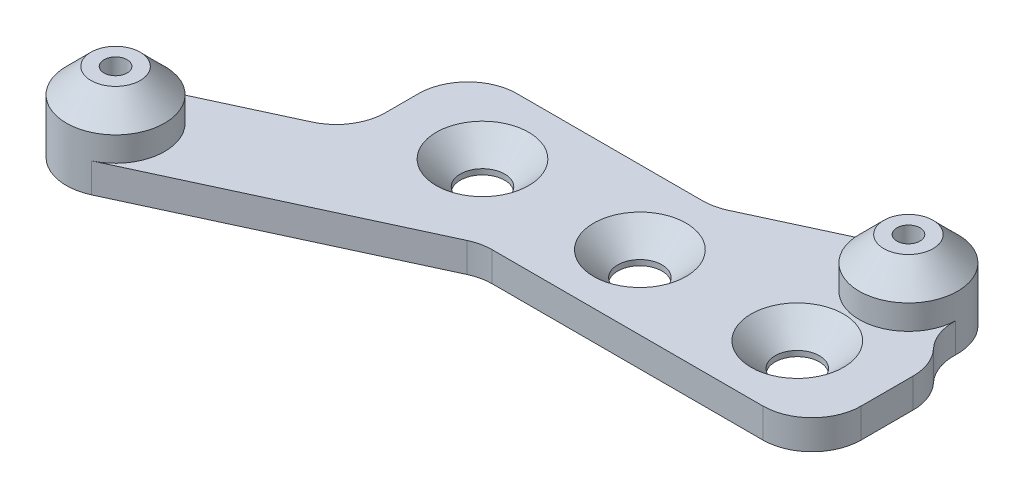
from build123d import *

# Parameters (mm, degrees)
BOSS_EXTRUDE2_DEPTH                          = 3
SKETCH4_W                                    = 50
SKETCH4_H                                    = 15
BOSS_EXTRUDE3_DEPTH                          = 3
SKETCH6_R                                    = 5
BOSS_EXTRUDE4_DEPTH                          = 5
FILLET1_R                                    = 5
FILLET2_R                                    = 5
CSK_FOR_M4_COUNTERSUNK_FLAT_HEAD_SCR_2_COUNT = 2
CSK_FOR_M4_COUNTERSUNK_FLAT_HEAD_SCR_2_PITCH = 16
CSK_FOR_M4_COUNTERSUNK_FLAT_HEAD_SCR_3_COUNT = 2
CSK_FOR_M4_COUNTERSUNK_FLAT_HEAD_SCR_3_PITCH = 16
SKETCH9_R                                    = 1.175
CUT_EXTRUDE2_DEPTH                           = 49.125772869
CHAMFER1_SIZE                                = 2.5


with BuildPart() as part:
    # Sketch2 → Boss-Extrude2 (new body)
    with BuildSketch(Plane(origin=(0, 0, 0), x_dir=(1, 0, 0), z_dir=(0, 1, 0))):
        with BuildLine():
            Line((-35.700010115, -20.037625203), (19.399989885, 5.462374797))
            ThreePointArc((19.399989885, 5.462374797), (21.837625203, 12.099989885), (15.200010115, 14.537625203))
            Line((15.200010115, 14.537625203), (-39.899989885, -10.962374797))
            ThreePointArc((-39.899989885, -10.962374797), (-42.337625203, -17.599989885), (-35.700010115, -20.037625203))
        make_face()
    extrude(amount=BOSS_EXTRUDE2_DEPTH)

    # Sketch4 → Boss-Extrude3 (add)
    with BuildSketch(Plane(origin=(0, 0, 0), x_dir=(1, 0, 0), z_dir=(0, 1, 0))):
        Rectangle(SKETCH4_W, SKETCH4_H)
    extrude(amount=BOSS_EXTRUDE3_DEPTH)

    # Sketch6 → Boss-Extrude4 (add)
    with BuildSketch(Plane(origin=(0, 3, 0), x_dir=(1, 0, 0), z_dir=(0, 1, 0))):
        with Locations(Location((-37.8, -15.5, 0), (0, 0, 114.834459772))):
            Circle(SKETCH6_R)
        with Locations(Location((17.3, 10, 0), (0, 0, 114.834459772))):
            Circle(SKETCH6_R)
    extrude(amount=BOSS_EXTRUDE4_DEPTH)

    # Fillet1
    # the kernel refuses this fillet: 5 mm, written as the material it adds along each edge
    with BuildSketch(Plane(origin=(-25, 0, 4.066735195), x_dir=(0, 0, -1), z_dir=(0, 1, 0))) as fillet1_piece_1:
        with BuildLine():
            CenterArc((FILLET1_R * 0.639103051734, FILLET1_R), FILLET1_R, 204.834459772, 65.165540228)
            Line((-FILLET1_R * 0.268421988848, FILLET1_R * 0.580002022961), (0, 0))
            Line((0, 0), (FILLET1_R * 0.639103051734, 0))
        make_face()
    extrude(amount=3)
    with BuildSketch(Plane(origin=(-0.00678003, 3, -7.5), x_dir=(0.9075250405819563, 0, -0.419997977038841), z_dir=(0, -1, 0)), Plane(origin=(-8.608906245, 3, 7.5), x_dir=(-0.9075250405819576, 0, 0.41999797703883784), z_dir=(0, -1, 0))) as fillet1_piece_2:
        with BuildLine():
            CenterArc((FILLET1_R * 0.220179535316, -FILLET1_R), FILLET1_R, 90, 24.834459772)
            Line((-FILLET1_R * 0.199818441723, -FILLET1_R * 0.092474959418), (0, 0))
            Line((0, 0), (FILLET1_R * 0.220179535316, 0))
        make_face()
    extrude(amount=3)
    # the kernel refuses this fillet: 5 mm, written as the material it takes off along each edge
    with BuildSketch(Plane(origin=(25, -11.817012604, -7.5), x_dir=(0, 0, 1), z_dir=(0, 1, 0))) as fillet1_2_piece_1:
        with BuildLine():
            CenterArc((4.726805042, -5), FILLET1_R, 90, 70.972289662)
            Line((0, -3.369872981), (0, 0))
            Line((0, 0), (4.726805042, 0))
        make_face()
    extrude(amount=26.634025208, mode=Mode.SUBTRACT)
    with BuildSketch(Plane(origin=(-25, -12.5, -7.5), x_dir=(1, 0, 0), z_dir=(0, 1, 0)), Plane(origin=(25, -12.5, 7.5), x_dir=(-1, 0, 0), z_dir=(0, 1, 0))) as fillet1_2_piece_2:
        with BuildLine():
            CenterArc((FILLET1_R, -FILLET1_R), FILLET1_R, 90, 90)
            Line((0, -FILLET1_R), (0, 0))
            Line((0, 0), (FILLET1_R, 0))
        make_face()
    extrude(amount=28, mode=Mode.SUBTRACT)

    # Fillet2
    fillet2_edges = [part.edges().sort_by_distance(p)[0] for p in [
        (21.630127019, 1.5, -7.5),
    ]]
    fillet(fillet2_edges, radius=FILLET2_R)

    # Sketch7 → CSK for M4 Countersunk Flat Head Screw1 (revolve, cut)
    with BuildSketch(Plane(origin=(0, 3, 0), x_dir=(0, 0, 1), z_dir=(1, 0, 0))):
        Polygon((0, 0), (0, 3.000025), (2.25, 3.000025), (2.25, 2.45), (4.7, 0), align=None)
    csk_for_m4_countersunk_flat_head_screw1 = revolve(axis=Axis((0, 9.35, 0), (0, -1, 0)), mode=Mode.SUBTRACT)

    # CSK for M4 Countersunk Flat Head Scr 2: CSK for M4 Countersunk Flat Head Screw1 ×2
    with Locations(*[(-i * CSK_FOR_M4_COUNTERSUNK_FLAT_HEAD_SCR_2_PITCH, 0, 0) for i in range(1, CSK_FOR_M4_COUNTERSUNK_FLAT_HEAD_SCR_2_COUNT)]):
        add(csk_for_m4_countersunk_flat_head_screw1, mode=Mode.SUBTRACT)

    # CSK for M4 Countersunk Flat Head Scr 3: CSK for M4 Countersunk Flat Head Screw1 ×2
    with Locations(*[(i * CSK_FOR_M4_COUNTERSUNK_FLAT_HEAD_SCR_3_PITCH, 0, 0) for i in range(1, CSK_FOR_M4_COUNTERSUNK_FLAT_HEAD_SCR_3_COUNT)]):
        add(csk_for_m4_countersunk_flat_head_screw1, mode=Mode.SUBTRACT)

    # Sketch9 → Cut-Extrude2 (cut, through all)
    with BuildSketch(Plane(origin=(0, 8, 0), x_dir=(1, 0, 0), z_dir=(0, 1, 0))):
        with Locations(Location((-37.8, -15.5, 0), (0, 0, 270))):
            Circle(SKETCH9_R)
        with Locations(Location((17.3, 10, 0), (0, 0, 270))):
            Circle(SKETCH9_R)
    extrude(amount=-CUT_EXTRUDE2_DEPTH, mode=Mode.SUBTRACT)

    # Chamfer1
    chamfer1_edges = [part.edges().sort_by_distance(p)[0] for p in [
        (-35.700010115, 8, 20.037625203),
        (19.399989885, 8, -5.462374797),
    ]]
    chamfer(chamfer1_edges, length=CHAMFER1_SIZE)


solid = part.part
